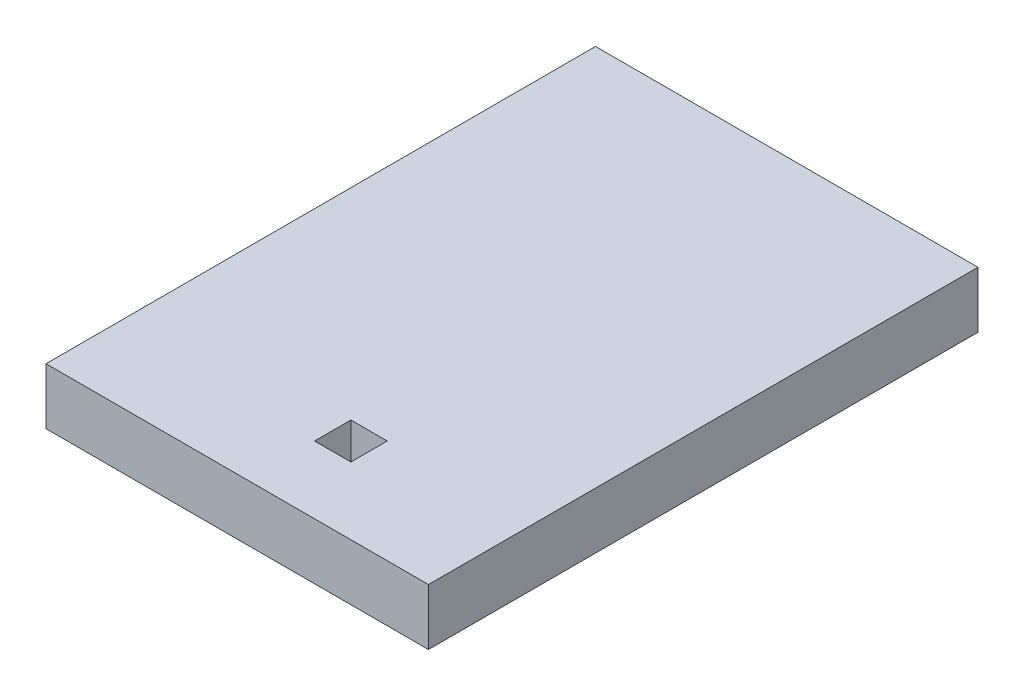
from build123d import *

# Parameters (mm, degrees)
SKETCH1_W           = 21.575
SKETCH1_H           = 31
SKETCH1_W_2         = 2.05
SKETCH1_H_2         = 2.05
BOSS_EXTRUDE1_DEPTH = 3.175


with BuildPart() as part:
    # Sketch1 → Boss-Extrude1 (new body)
    with BuildSketch(Plane(origin=(0, 0, 0), x_dir=(1, 0, 0), z_dir=(0, 1, 0))):
        with Locations((-1.5875, 0)):
            Rectangle(SKETCH1_W, SKETCH1_H)
        with Locations((0, -10.675)):
            Rectangle(SKETCH1_W_2, SKETCH1_H_2, mode=Mode.SUBTRACT)
    extrude(amount=BOSS_EXTRUDE1_DEPTH)


solid = part.part
